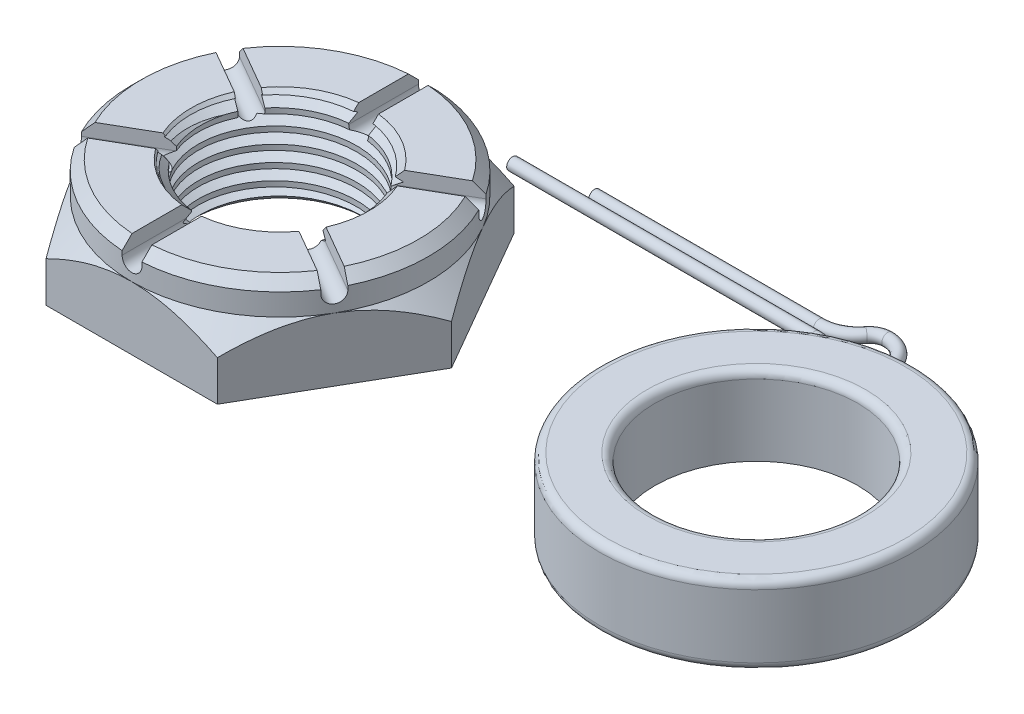
from build123d import *

# Parameters (mm, degrees)
SKETCH1_R           = 10
BOSS_EXTRUDE1_DEPTH = 8
SKETCH2_OUTSIDE_W   = 72.87
SKETCH2_OUTSIDE_H   = 67.068
SKETCH2_OUTSIDE_R   = 18.75
CUT_EXTRUDE1_DEPTH  = 8
CUT_EXTRUDE1_DRAFT  = -45
SKETCH3_R           = 18.75
SKETCH3_R_2         = 10
BOSS_EXTRUDE2_DEPTH = 4
CHAMFER1_SIZE       = 1.25
CUT_EXTRUDE2_DEPTH  = 32.053381458
CIRPATTERN1_COUNT   = 6
CHAMFER2_SIZE       = 1.25
CHAMFER3_SIZE       = 1
CUT_SWEEP1_PITCH    = 2
SKETCH8_R           = 19.811670457
SKETCH8_R_2         = 12.811670457
EXTRUDE_THIN1_DEPTH = 10
SKETCH10_R          = 0.75
FILLET1_R           = 1


with BuildPart() as part:
    # Sketch1 → Boss-Extrude1 (new body)
    with BuildSketch(Plane(origin=(0, 0, 0), x_dir=(1, 0, 0), z_dir=(0, 1, 0))):
        Polygon((21.650635095, 0), (10.825317547, 18.75), (-10.825317547, 18.75), (-21.650635095, 0), (-10.825317547, -18.75), (10.825317547, -18.75), align=None)
        with Locations(Location((0, 0, 0), (0, 0, 270))):
            Circle(SKETCH1_R, mode=Mode.SUBTRACT)
    extrude(amount=BOSS_EXTRUDE1_DEPTH)


with BuildPart() as cut_extrude1_tool:
    # Sketch2 outside → Cut-Extrude1 (with draft: the straight prism first)
    with BuildSketch(Plane(origin=(0, 8, 0), x_dir=(1, 0, 0), z_dir=(0, 1, 0))):
        Rectangle(SKETCH2_OUTSIDE_W, SKETCH2_OUTSIDE_H)
        Circle(SKETCH2_OUTSIDE_R, mode=Mode.SUBTRACT)
    extrude(amount=-CUT_EXTRUDE1_DEPTH)
    # Cut-Extrude1: the draft: its side faces are tilted about the plane it starts from
    cut_extrude1_sides = [cut_extrude1_tool.faces().sort_by_distance(p)[0] for p in [
        (0, 4, 33.534),
        (36.435, 4, 0),
        (0, 4, -33.534),
        (-36.435, 4, 0),
        (-18.75, 4, 0),
    ]]
    draft(cut_extrude1_sides, Plane(origin=(0, 8, 0), x_dir=(1, 0, 0), z_dir=(0, 1, 0)), CUT_EXTRUDE1_DRAFT)


with BuildPart() as part_1:
    add(part.part)

    # Cut-Extrude1: cut by cut_extrude1_tool
    add(cut_extrude1_tool.part, mode=Mode.SUBTRACT)

    # Sketch3 → Boss-Extrude2 (add)
    with BuildSketch(Plane(origin=(0, 8, 0), x_dir=(1, 0, 0), z_dir=(0, 1, 0))):
        with Locations(Location((0, 0, 0), (0, 0, 270))):
            Circle(SKETCH3_R)
        with Locations(Location((0, 0, 0), (0, 0, 270))):
            Circle(SKETCH3_R_2, mode=Mode.SUBTRACT)
    extrude(amount=BOSS_EXTRUDE2_DEPTH)

    # Chamfer1
    chamfer1_edges = [part_1.edges().sort_by_distance(p)[0] for p in [
        (0, 12, -18.75),
    ]]
    chamfer(chamfer1_edges, length=CHAMFER1_SIZE)

    # Sketch4 → Cut-Extrude2 (cut, through all)
    with BuildSketch(Plane.XY):
        with BuildLine():
            Line((-1.25, 10.25), (-1.25, 13.863340399))
            Line((-1.25, 13.863340399), (1.25, 13.863340399))
            Line((1.25, 13.863340399), (1.25, 10.25))
            ThreePointArc((1.25, 10.25), (0, 9), (-1.25, 10.25))
        make_face()
    cut_extrude2 = extrude(amount=-CUT_EXTRUDE2_DEPTH, mode=Mode.SUBTRACT)

    # CirPattern1: Cut-Extrude2 ×6 about axis
    cirpattern1_axis = Axis((0, 0, 0), (0, 1, 0))
    for i in range(1, CIRPATTERN1_COUNT):
        add(cut_extrude2.rotate(cirpattern1_axis, i * 360 / CIRPATTERN1_COUNT), mode=Mode.SUBTRACT)

    # Chamfer2
    chamfer2_edges = [part_1.edges().sort_by_distance(p)[0] for p in [
        (5, 12, -8.660254038),
        (10, 12, 0),
        (5, 12, 8.660254038),
        (-5, 12, 8.660254038),
        (-10, 12, 0),
        (-5, 12, -8.660254038),
    ]]
    chamfer(chamfer2_edges, length=CHAMFER2_SIZE)

    # Chamfer3
    chamfer3_edges = [part_1.edges().sort_by_distance(p)[0] for p in [
        (0, 0, -10),
    ]]
    chamfer(chamfer3_edges, length=CHAMFER3_SIZE)

    # Cut-Sweep1: the profile of Sketch7 screwed along a right-hand helix of 11 turns, 10 arcs to a turn; built about Z, then put on its axis
    cut_sweep1_z = Axis((0, 0, 0), (0, 0, 1))
    cut_sweep1_corners = [(11.148927036, 0, 0), (9.425536482, 0, 0.995), (9.425536482, 0, -0.995)]
    with BuildLine(mode=Mode.PRIVATE) as cut_sweep1_profile:
        Line(cut_sweep1_corners[0], cut_sweep1_corners[1])
        Line(cut_sweep1_corners[1], cut_sweep1_corners[2])
        Line(cut_sweep1_corners[2], cut_sweep1_corners[0])
    cut_sweep1_cap = Face(cut_sweep1_profile.wire())
    cut_sweep1_turn_angles = [0, 18, 36, 54, 72, 90, 108, 126, 144, 162, 180, 198, 216, 234, 252, 270, 288, 306, 324, 342, 360]
    cut_sweep1_turn_weights = [1, 0.9510565162951535, 1, 0.9510565162951535, 1, 0.9510565162951535, 1, 0.9510565162951535, 1, 0.9510565162951535, 1, 0.9510565162951535, 1, 0.9510565162951535, 1, 0.9510565162951535, 1, 0.9510565162951535, 1, 0.9510565162951535, 1]
    cut_sweep1_turn_rails = [Edge.make_bspline([Vector(p[0], p[1], 0).rotate(cut_sweep1_z, cut_sweep1_turn_angles[k]) / cut_sweep1_turn_weights[k] + Vector(0, 0, p[2] + CUT_SWEEP1_PITCH * cut_sweep1_turn_angles[k] / 360) for k in range(21)], [0, 0, 0, 1, 1, 2, 2, 3, 3, 4, 4, 5, 5, 6, 6, 7, 7, 8, 8, 9, 9, 10, 10, 10], 2, cut_sweep1_turn_weights) for p in cut_sweep1_corners]
    cut_sweep1_turn_sides = [Face.make_surface_from_curves(cut_sweep1_turn_rails[p[0]], cut_sweep1_turn_rails[p[1]]) for p in [(0, 1), (1, 2), (2, 0)]]
    cut_sweep1 = Plane(origin=(0, -5, 0), x_dir=(0, 0, -1), z_dir=(0, 1, 0)) * Solid(Shell([*[p.moved(Location((0, 0, CUT_SWEEP1_PITCH * i))) for i in range(11) for p in cut_sweep1_turn_sides], cut_sweep1_cap, cut_sweep1_cap.rotate(cut_sweep1_z, 3960).moved(Location((0, 0, CUT_SWEEP1_PITCH * 3960 / 360)))]))
    add(cut_sweep1, mode=Mode.SUBTRACT)


with BuildPart() as body_2:
    # Sketch8 → Extrude-Thin1 (new body)
    with BuildSketch(Plane(origin=(0, 0, 0), x_dir=(1, 0, 0), z_dir=(0, 1, 0))):
        with Locations((60.168179444, 0)):
            Circle(SKETCH8_R)
        with Locations((60.168179444, 0)):
            Circle(SKETCH8_R_2, mode=Mode.SUBTRACT)
    extrude(amount=EXTRUDE_THIN1_DEPTH)

    # Fillet1
    fillet1_edges = [body_2.edges().sort_by_distance(p)[0] for p in [
        (40.356508987, 0, 0),
        (40.356508987, 10, 0),
        (47.356508987, 10, 0),
    ]]
    fillet(fillet1_edges, radius=FILLET1_R)


with BuildPart() as body_3:
    # Sweep1: sweep along a path in Sketch9
    with BuildLine(Plane(origin=(0, 0, 0), x_dir=(1, 0, 0), z_dir=(0, 1, 0))) as sweep1_path:
        Line((3.133218286, 26.240195982), (41.305218048, 26.240195982))
        ThreePointArc((41.305218048, 26.240195982), (43.171683372, 25.878763346), (44.768308103, 24.84671886))
        ThreePointArc((44.768308103, 24.84671886), (45.397711595, 24.442979668), (46.133285559, 24.308499053))
        ThreePointArc((46.133285559, 24.308499053), (49.289019963, 27.553430935), (46.044088081, 30.70916534))
        ThreePointArc((46.044088081, 30.70916534), (45.031633241, 30.461824719), (44.228445264, 29.797647588))
        ThreePointArc((44.228445264, 29.797647588), (42.472867841, 28.35618316), (40.260713006, 27.840195982))
        Line((40.260713006, 27.840195982), (11.87664113, 27.840195982))
    # Sketch10 → Sweep1 (sweep)
    with BuildSketch(Plane(origin=(3.133218286, 0, -26.240195982), x_dir=(0, 0, -1), z_dir=(1, 0, 0))):
        Circle(SKETCH10_R)
    sweep(path=sweep1_path.line)


solid = Compound([part_1.part, body_2.part, body_3.part])
